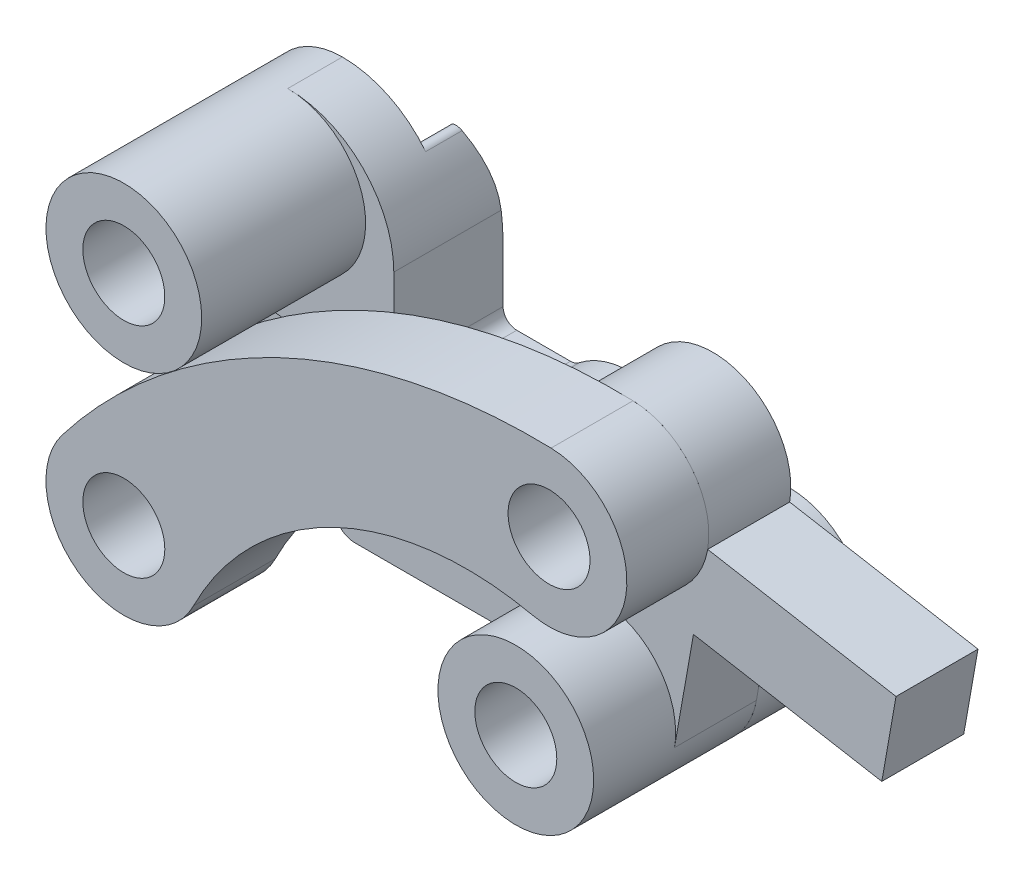
from build123d import *

# Parameters (mm, degrees)
SKETCH1_R            = 2.85
BOSS_EXTRUDE1_DEPTH  = 10
SKETCH1_3_R          = 2
BOSS_EXTRUDE2_DEPTH  = 4
SKETCH2_R            = 2.85
BOSS_EXTRUDE3_DEPTH  = 3
BOSS_EXTRUDE5_DEPTH  = 3
HOLE1_START          = 4
HOLE1_OUTLINE_R      = 1.5
HOLE1_DEPTH          = 3
HOLE1_START_2        = 7
HOLE1_2_OUTLINE_R    = 1.5
HOLE1_2_DEPTH        = 3
HOLE2_START          = 4
HOLE2_OUTLINE_R      = 1.5
HOLE2_DEPTH          = 3
HOLE2_2_OUTLINE_R    = 1.5
HOLE2_2_DEPTH        = 4
HOLE3_START          = -1
HOLE3_OUTLINE_R      = 1.5
HOLE3_DEPTH          = 11
HOLE4_OUTLINE_R      = 1.5
HOLE4_DEPTH          = 4
HOLE5_START          = 7
HOLE5_OUTLINE_R      = 1.5
HOLE5_DEPTH          = 3
SKETCH9_R            = 1.5
CUT_EXTRUDE1_DEPTH   = 2
CUT_EXTRUDE2_START   = -2
SKETCH10_R           = 3
SKETCH10_R_2         = 1.5
CUT_EXTRUDE2_DEPTH   = 2
SKETCH13_R           = 1.5
BOSS_EXTRUDE7_DEPTH  = 3
MOVE_START           = 3.380946094
MOVE_FACE1_OUTLINE_W = 7
MOVE_FACE1_OUTLINE_H = 6
MOVE_FACE1_DEPTH     = 2.619053906
FILLET3_R            = 10
FILLET4_START        = 0.070618077
FILLET4_DEPTH        = 1.929381923
FILLET6_R            = 0.75
FILLET1_R            = 0.5
FILLET2_R            = 6
FILLET7_R            = 0.75
BOSS_EXTRUDE6_DEPTH  = 3


with BuildPart() as part:
    # Sketch1 → Boss-Extrude1 (new body)
    with BuildSketch(Plane.XY):
        with Locations((0, 8)):
            Circle(SKETCH1_R)
    extrude(amount=BOSS_EXTRUDE1_DEPTH)

    # Sketch1<3> → Boss-Extrude2 (add)
    with BuildSketch(Plane.XY):
        with BuildLine():
            ThreePointArc((-3.288892787, 1.613938628), (-3.021777735, -1.057195592), (-0.653668071, -2.321460236))
            Line((-0.653668071, -2.321460236), (14.346331929, -2.321460236))
            ThreePointArc((14.346331929, -2.321460236), (17.196331929, 0.528539764), (14.346331929, 3.378539764))
            Line((14.346331929, 3.378539764), (10.52622042, 3.378539764))
            ThreePointArc((10.52622042, 3.378539764), (8.52842804, 4.140499191), (6.530635661, 3.378539764))
            Line((6.530635661, 3.378539764), (3.880617573, 3.378539764))
            Line((3.880617573, 3.378539764), (3.880617573, 6.969382427))
            ThreePointArc((3.880617573, 6.969382427), (2.744011001, 9.713393428), (0, 10.85))
            ThreePointArc((0, 10.85), (2.220892349, 6.213904489), (-2.783667267, 7.388692754))
            ThreePointArc((-2.783667267, 7.388692754), (-2.594814655, 4.462692475), (-3.288892787, 1.613938628))
        make_face()
        with Locations((8.52842804, 1.140499191)):
            Circle(SKETCH1_3_R, mode=Mode.SUBTRACT)
    extrude(amount=BOSS_EXTRUDE2_DEPTH)

    # Hole2 2 outline → Hole2 2 (cut)
    with BuildSketch(Plane.XY):
        with Locations((14.346331929, 0.528539764)):
            Circle(HOLE2_2_OUTLINE_R)
    extrude(amount=HOLE2_2_DEPTH, mode=Mode.SUBTRACT)

    # Hole3: read off the stored shape, not the designer's step
    # Hole3 outline → Hole3 (cut)
    with BuildSketch(Plane.XY.offset(HOLE3_START)):
        with Locations((0, 8)):
            Circle(HOLE3_OUTLINE_R)
    extrude(amount=HOLE3_DEPTH, mode=Mode.SUBTRACT)

    # Hole4: read off the stored shape, not the designer's step
    # Hole4 outline → Hole4 (cut)
    with BuildSketch(Plane.XY):
        with Locations((-0.653668071, 0.528539764)):
            Circle(HOLE4_OUTLINE_R)
    extrude(amount=HOLE4_DEPTH, mode=Mode.SUBTRACT)

    # Sketch9 → Cut-Extrude1 (cut)
    with BuildSketch(Plane(origin=(0, 0, 0), x_dir=(-1, 0, 0), z_dir=(0, 0, -1))):
        with BuildLine():
            ThreePointArc((2.783667267, 7.388692754), (2.833368288, 7.692552207), (2.85, 8))
            ThreePointArc((2.85, 8), (2.015254326, 10.015254326), (0, 10.85))
            ThreePointArc((0, 10.85), (-2.220892349, 6.213904489), (2.783667267, 7.388692754))
        make_face()
        with Locations((0, 8)):
            Circle(SKETCH9_R, mode=Mode.SUBTRACT)
    extrude(amount=-CUT_EXTRUDE1_DEPTH, mode=Mode.SUBTRACT)

    # Sketch10 → Cut-Extrude2 (cut)
    with BuildSketch(Plane.XY.offset(4).offset(CUT_EXTRUDE2_START)):
        with Locations((-0.653668071, 0.528539764)):
            Circle(SKETCH10_R)
        with Locations(Location((-0.653668071, 0.528539764, 0), (0, 0, 180))):
            Circle(SKETCH10_R_2, mode=Mode.SUBTRACT)
    extrude(amount=CUT_EXTRUDE2_DEPTH, mode=Mode.SUBTRACT)

    # Move Face1: read off the stored shape, not the designer's step
    # Move Face1 outline → Move Face1 (cut)
    with BuildSketch(Plane(origin=(0, 0, 0), x_dir=(1, 0, 0), z_dir=(0, 0.4226182617406999, -0.9063077870366498)).offset(MOVE_START)):
        with Locations((1.5, -9)):
            Rectangle(MOVE_FACE1_OUTLINE_W, MOVE_FACE1_OUTLINE_H)
    extrude(amount=MOVE_FACE1_DEPTH, mode=Mode.SUBTRACT)

    # Fillet3
    fillet3_edges = [part.edges().sort_by_distance(p)[0] for p in [
        (3.295629584, 8, 0),
    ]]
    fillet(fillet3_edges, radius=FILLET3_R)

    # Fillet4: read off the stored shape, not the designer's step
    # Fillet4 outline → Fillet4 (cut)
    with BuildSketch(Plane.XY.offset(FILLET4_START)):
        with BuildLine():
            ThreePointArc((2.621064074, 9.119161794), (2.723389269, 9.432322489), (3.047297197, 9.37212514))
            ThreePointArc((3.047297197, 9.37212514), (1.693379336, 10.461038076), (0, 10.85))
            ThreePointArc((0, 10.85), (1.570491784, 10.378246319), (2.621064074, 9.119161794))
        make_face()
    extrude(amount=FILLET4_DEPTH, mode=Mode.SUBTRACT)

    # Fillet6
    # the kernel refuses this fillet: 0.75 mm, written as the material it takes off along each edge
    with BuildSketch(Plane(origin=(-2.783667267, 7.388692754, -6.191769665), x_dir=(0.5884037182899365, -0.80856729114068, 0), z_dir=(0, 0, 1))) as fillet6_piece_1:
        with BuildLine():
            CenterArc((2.588231391, -0.686967831), FILLET6_R, 113.657983214, 118.014627982)
            ThreePointArc((2.123115813, -1.275327839), (1.102428919, -0.569623459), (0, 0))
            ThreePointArc((0, 0), (1.143637126, -0.239522242), (2.287274252, 0))
        make_face()
    extrude(amount=8.191769665, mode=Mode.SUBTRACT)

    # Fillet1
    fillet1_edges = [part.edges().sort_by_distance(p)[0] for p in [
        (3.880617573, 3.378539764, 2),
        (6.530635661, 3.378539764, 2),
    ]]
    fillet(fillet1_edges, radius=FILLET1_R)

    # Fillet2
    fillet2_edges = [part.edges().sort_by_distance(p)[0] for p in [
        (10.52622042, 3.378539764, 2),
    ]]
    fillet(fillet2_edges, radius=FILLET2_R)

    # Fillet7
    fillet7_edges = [part.edges().sort_by_distance(p)[0] for p in [
        (-3.007860636, 2.388049745, 3),
        (0.283081629, -2.321460236, 3),
    ]]
    fillet(fillet7_edges, radius=FILLET7_R)


with BuildPart() as body_2:
    # Sketch2 → Boss-Extrude3 (new body)
    with BuildSketch(Plane.XY.offset(10)):
        Circle(SKETCH2_R)
        with BuildLine():
            ThreePointArc((-2.260997744, 1.73504732), (0.916148577, 2.69873522), (2.85, 0))
            ThreePointArc((2.85, 0), (2.77335805, -0.656494575), (2.547554297, -1.277680361))
            ThreePointArc((2.547554297, -1.277680361), (7.734848749, 3.807723671), (14.951458123, 4.638330111))
            ThreePointArc((14.951458123, 4.638330111), (12.732714566, 7.766264099), (15.636506436, 10.271216548))
            ThreePointArc((15.636506436, 10.271216548), (5.663103388, 8.151483767), (-2.260997744, 1.73504732))
        make_face()
        with Locations((15.561869173, 7.422194035)):
            Circle(SKETCH2_R)
    extrude(amount=-BOSS_EXTRUDE3_DEPTH)

    # Hole1 2 outline → Hole1 2 (cut)
    with BuildSketch(Plane.XY.offset(HOLE1_START_2)):
        with Locations((15.561869173, 7.422194035)):
            Circle(HOLE1_2_OUTLINE_R)
    extrude(amount=HOLE1_2_DEPTH, mode=Mode.SUBTRACT)

    # Hole5: read off the stored shape, not the designer's step
    # Hole5 outline → Hole5 (cut)
    with BuildSketch(Plane.XY.offset(HOLE5_START)):
        Circle(HOLE5_OUTLINE_R)
    extrude(amount=HOLE5_DEPTH, mode=Mode.SUBTRACT)


with BuildPart() as body_3:
    # Sketch3 → Boss-Extrude5 (new body)
    with BuildSketch(Plane(origin=(0, 0, 7), x_dir=(-1, 0, 0), z_dir=(0, 0, -1))):
        with BuildLine():
            ThreePointArc((-12.755167077, 7.917091342), (-16.056766479, 10.228896131), (-18.368571269, 6.927296729))
            Line((-18.368571269, 6.927296729), (-17.153034025, 0.033642458))
            ThreePointArc((-17.153034025, 0.033642458), (-13.851434623, -2.278162332), (-11.539629833, 1.023437071))
            Line((-11.539629833, 1.023437071), (-12.755167077, 7.917091342))
        make_face()
    extrude(amount=BOSS_EXTRUDE5_DEPTH)

    # Hole1: read off the stored shape, not the designer's step
    # Hole1 outline → Hole1 (cut)
    with BuildSketch(Plane.XY.offset(HOLE1_START)):
        with Locations((15.561869173, 7.422194035)):
            Circle(HOLE1_OUTLINE_R)
    extrude(amount=HOLE1_DEPTH, mode=Mode.SUBTRACT)

    # Hole2: read off the stored shape, not the designer's step
    # Hole2 outline → Hole2 (cut)
    with BuildSketch(Plane.XY.offset(HOLE2_START)):
        with Locations((14.346331929, 0.528539764)):
            Circle(HOLE2_OUTLINE_R)
    extrude(amount=HOLE2_DEPTH, mode=Mode.SUBTRACT)

    # Sketch13 → Boss-Extrude7 (add)
    with BuildSketch(Plane.XY.offset(7)):
        with BuildLine():
            ThreePointArc((17.153034025, 0.033642458), (17.185486819, 0.280145897), (17.196331929, 0.528539764))
            ThreePointArc((17.196331929, 0.528539764), (14.594725796, 3.367694654), (11.539629833, 1.023437071))
            ThreePointArc((11.539629833, 1.023437071), (13.851434623, -2.278162332), (17.153034025, 0.033642458))
        make_face()
        with Locations((14.346331929, 0.528539764)):
            Circle(SKETCH13_R, mode=Mode.SUBTRACT)
    extrude(amount=BOSS_EXTRUDE7_DEPTH)

    # Sketch12 → Boss-Extrude6 (add)
    with BuildSketch(Plane(origin=(0, 0, 4), x_dir=(-1, 0, 0), z_dir=(0, 0, -1))):
        Polygon((-18.368571269, 6.927296729), (-17.847626736, 3.97287347), (-24.741281007, 2.757336226), (-25.26222554, 5.711759485), align=None)
    extrude(amount=-BOSS_EXTRUDE6_DEPTH)


solid = Compound([part.part, body_2.part, body_3.part])
